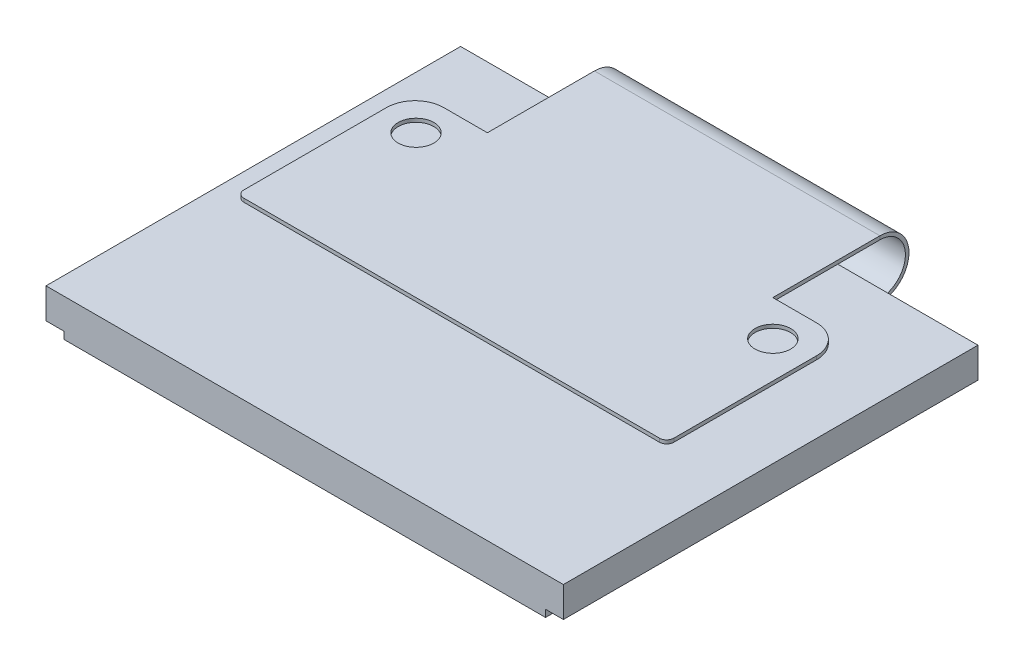
from build123d import *

# Parameters (mm, degrees)
SKETCH2_W           = 14.5
SKETCH2_H           = 11.62
BOSS_EXTRUDE1_DEPTH = 0.425
SKETCH6_W           = 13.5
SKETCH6_H           = 8.1
BOSS_EXTRUDE2_DEPTH = 0.2
SKETCH7_W           = 12.58
SKETCH7_H           = 6.98
BOSS_EXTRUDE3_DEPTH = 0.15
BOSS_EXTRUDE4_DEPTH = 0.17547
FILLET1_R           = 0.762
FILLET2_R           = 0.2
SKETCH13_W          = 8
SKETCH13_H          = 0.1
SKETCH14_W          = 2.0249
SKETCH14_H          = 5
BOSS_EXTRUDE6_DEPTH = 0.1
SKETCH17_R          = 0.5
CUT_EXTRUDE3_DEPTH  = 0.1
FILLET3_R           = 0.2
FILLET4_R           = 0.8


with BuildPart() as part:
    # Sketch2 → Boss-Extrude1 (new, symmetric)
    with BuildSketch(Plane(origin=(0, 0, 0), x_dir=(1, 0, 0), z_dir=(0, 1, 0))):
        Rectangle(SKETCH2_W, SKETCH2_H)
    extrude(amount=BOSS_EXTRUDE1_DEPTH, both=True)

    # Sketch6 → Boss-Extrude2 (add)
    with BuildSketch(Plane.XZ.offset(0.425)):
        with Locations((0, 1.76)):
            Rectangle(SKETCH6_W, SKETCH6_H)
    extrude(amount=BOSS_EXTRUDE2_DEPTH)

    # Sketch7 → Boss-Extrude3 (add)
    with BuildSketch(Plane.XZ.offset(0.625)):
        with Locations((0, 1.51)):
            Rectangle(SKETCH7_W, SKETCH7_H)
    extrude(amount=BOSS_EXTRUDE3_DEPTH)

    # Sketch9 → Boss-Extrude4 (add)
    with BuildSketch(Plane.XZ.offset(0.425)):
        Polygon((-6.096, -2.452696), (6.096, -2.452696), (6.096, -4.992696), (3.2893, -4.992696), (3.2893, -7.856286), (-3.2893, -7.856286), (-3.2893, -4.992696), (-6.096, -4.992696), align=None)
    extrude(amount=BOSS_EXTRUDE4_DEPTH)

    # Fillet1
    fillet1_edges = [part.edges().sort_by_distance(p)[0] for p in [
        (6.096, -0.512735, -4.992696),
        (-6.096, -0.512735, -4.992696),
    ]]
    fillet(fillet1_edges, radius=FILLET1_R)

    # Fillet2
    fillet2_edges = [part.edges().sort_by_distance(p)[0] for p in [
        (3.2893, -0.512735, -7.856286),
        (-3.2893, -0.512735, -7.856286),
    ]]
    fillet(fillet2_edges, radius=FILLET2_R)

    # Sweep2: sweep along a path in Sketch12
    with BuildLine(Plane(origin=(0, 0, 0), x_dir=(0, 0, -1), z_dir=(1, 0, 0))) as sweep2_path:
        Line((5.81, -0.425), (6.31, -0.425))
        ThreePointArc((6.31, -0.425), (7.125, 0.39), (6.31, 1.205))
        Line((6.31, 1.205), (-1.69, 1.205))
    # Sketch13 → Sweep2 (sweep)
    with BuildSketch(Plane(origin=(0, 0, -5.81), x_dir=(-1, 0, 0), z_dir=(0, 0, -1))):
        with Locations((0, -0.375)):
            Rectangle(SKETCH13_W, SKETCH13_H)
    sweep(path=sweep2_path.line)

    # Sketch14 → Boss-Extrude6 (add)
    with BuildSketch(Plane(origin=(0, 1.205, 0), x_dir=(1, 0, 0), z_dir=(0, 1, 0))):
        with Locations((-5.01245, 0.81)):
            Rectangle(SKETCH14_W, SKETCH14_H)
        with Locations((5.01245, 0.81)):
            Rectangle(SKETCH14_W, SKETCH14_H)
    extrude(amount=-BOSS_EXTRUDE6_DEPTH)

    # Sketch17 → Cut-Extrude3 (cut)
    with BuildSketch(Plane(origin=(0, 1.205, 0), x_dir=(1, 0, 0), z_dir=(0, 1, 0))):
        with Locations((-5, 2.31)):
            Circle(SKETCH17_R)
        with Locations((5, 2.31)):
            Circle(SKETCH17_R)
    extrude(amount=-CUT_EXTRUDE3_DEPTH, mode=Mode.SUBTRACT)

    # Fillet3
    fillet3_edges = [part.edges().sort_by_distance(p)[0] for p in [
        (6.0249, 1.155, 1.69),
        (-6.0249, 1.155, 1.69),
    ]]
    fillet(fillet3_edges, radius=FILLET3_R)

    # Fillet4
    fillet4_edges = [part.edges().sort_by_distance(p)[0] for p in [
        (6.0249, 1.155, -3.31),
        (-6.0249, 1.155, -3.31),
    ]]
    fillet(fillet4_edges, radius=FILLET4_R)


solid = part.part
